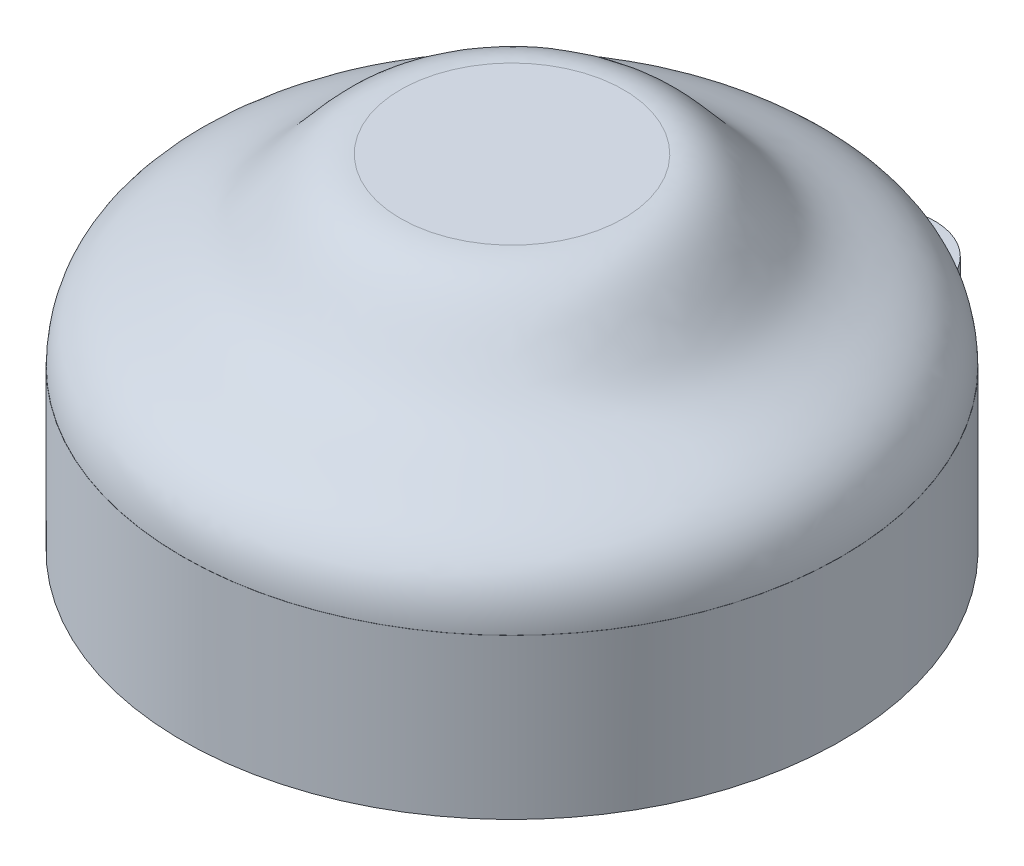
from build123d import *

# Parameters (mm, degrees)
SKETCH3_R           = 26.878
SKETCH3_R_2         = 26.128
BOSS_EXTRUDE1_DEPTH = 13
SKETCH5_R           = 1.65
BOSS_EXTRUDE4_DEPTH = 5.5
CUT_EXTRUDE1_DEPTH  = 3.5
BOSS_EXTRUDE5_START = -3.5
BOSS_EXTRUDE5_DEPTH = 1.5
FILLET1_DEPTH       = 3.5
FILLET1_2_DEPTH     = 5.5
FILLET1_START       = 3.5
FILLET1_3_DEPTH     = 2


with BuildPart() as part:
    # Sketch3 → Boss-Extrude1 (new body)
    with BuildSketch(Plane(origin=(0, 0, 0), x_dir=(1, 0, 0), z_dir=(0, 1, 0))):
        with Locations(Location((0, 0, 0), (0, 0, 90))):
            Circle(SKETCH3_R)
        with Locations(Location((0, 0, 0), (0, 0, 90))):
            Circle(SKETCH3_R_2, mode=Mode.SUBTRACT)
    extrude(amount=BOSS_EXTRUDE1_DEPTH)

    # Sketch5 → Boss-Extrude4 (add)
    with BuildSketch(Plane.XZ):
        with BuildLine():
            Line((-5.543162198, -29.995394675), (-5.543162198, -26.300194616))
            ThreePointArc((-5.543162198, -26.300194616), (-0.534858171, -26.863033142), (4.491880525, -26.499997988))
            Line((4.491880525, -26.499997988), (4.491880525, -29.995394675))
            ThreePointArc((4.491880525, -29.995394675), (-0.525640836, -35.012916036), (-5.543162198, -29.995394675))
        make_face()
        with Locations(Location((-0.525640836, -29.995394675, 0), (0, 0, 270))):
            Circle(SKETCH5_R, mode=Mode.SUBTRACT)
    extrude(amount=-BOSS_EXTRUDE4_DEPTH)

    # Sketch6 → Cut-Extrude1 (cut)
    with BuildSketch(Plane(origin=(0, 0, 0), x_dir=(-1, 0, 0), z_dir=(0, -1, 0))):
        with BuildLine():
            Line((4.710133197, 29.995394675), (4.710133197, 25.699942204))
            ThreePointArc((4.710133197, 25.699942204), (0.530383369, 26.096098926), (-3.658851524, 25.81760336))
            Line((-3.658851524, 25.81760336), (-3.658851524, 29.995394675))
            ThreePointArc((-3.658851524, 29.995394675), (0.525640836, 34.179887036), (4.710133197, 29.995394675))
        make_face()
    extrude(amount=-CUT_EXTRUDE1_DEPTH, mode=Mode.SUBTRACT)

    # Sketch8 → Boss-Extrude5 (add)
    with BuildSketch(Plane.XZ.offset(BOSS_EXTRUDE5_START)):
        with BuildLine():
            Line((-24.490295897, -5.022490106), (-25.599662863, -5.25))
            ThreePointArc((-25.599662863, -5.25), (0, -26.132455658), (25.599662863, -5.25))
            Line((25.599662863, -5.25), (24.490295897, -5.022490106))
            ThreePointArc((24.490295897, -5.022490106), (0, -25), (-24.490295897, -5.022490106))
        make_face()
    extrude(amount=-BOSS_EXTRUDE5_DEPTH)

    # Sketch9 → Revolve2 (revolve)
    with BuildSketch(Plane.XY, mode=Mode.PRIVATE) as revolve2_sk:
        with BuildLine():
            Line((0, 28), (-9.101139649, 28))
            add(Edge.make_bspline(
                [(-26.865197812, 13), (-26.780347086, 19.183911548), (-16.270727798, 18.725740026), (-13.002848085, 28.026430598), (-9.101139649, 28)],
                knots=[0, 0, 0, 0, 0.568593296, 1, 1, 1, 1], degree=3))
            Line((-26.865197812, 13), (-26.077563706, 13))
            add(Edge.make_bspline(
                [(-26.077563706, 13), (-26.008610768, 18.688342048), (-15.742101247, 18.498770299), (-12.722171974, 27.285632832), (-8.970863985, 27.25)],
                knots=[0, 0, 0, 0, 0.575100983, 1, 1, 1, 1], degree=3))
            Line((-8.970863985, 27.25), (0, 27.25))
            Line((0, 27.25), (0, 28))
        make_face()
    revolve(revolve2_sk.sketch.rotate(Axis((0, 30.1875, 0), (0, -1, 0)), 99.620474841), axis=Axis((0, 30.1875, 0), (0, -1, 0)))

    # Fillet1: read off the stored shape, not the designer's step
    # Fillet1 outline → Fillet1 (cut)
    with BuildSketch(Plane(origin=(0, 0, 0), x_dir=(1, 0, 0), z_dir=(0, 1, 0))):
        with BuildLine():
            ThreePointArc((3.658851524, 25.870546757), (5.477109504, 25.547478456), (7.268005417, 25.096782289))
            ThreePointArc((7.268005417, 25.096782289), (6.09952046, 25.604116819), (5.097161214, 26.390260165))
            ThreePointArc((5.097161214, 26.390260165), (4.794834821, 26.446860741), (4.491880525, 26.499997988))
            Line((4.491880525, 26.499997988), (4.491880525, 27.136047571))
            ThreePointArc((4.491880525, 27.136047571), (3.87163652, 28.45633062), (3.658851524, 29.899442708))
            Line((3.658851524, 29.899442708), (3.658851524, 25.870546757))
        make_face()
        with BuildLine():
            ThreePointArc((-6.026648148, 26.19363274), (-7.000597737, 25.37255563), (-8.150422776, 24.824242034))
            ThreePointArc((-8.150422776, 24.824242034), (-6.445167778, 25.320588388), (-4.710133197, 25.699942204))
            Line((-4.710133197, 25.699942204), (-4.710133197, 29.574747629))
            ThreePointArc((-4.710133197, 29.574747629), (-4.922918193, 28.131635539), (-5.543162198, 26.81135249))
            Line((-5.543162198, 26.81135249), (-5.543162198, 26.300194616))
            ThreePointArc((-5.543162198, 26.300194616), (-5.785150535, 26.248026922), (-6.026648148, 26.19363274))
        make_face()
    extrude(amount=FILLET1_DEPTH, mode=Mode.SUBTRACT)

    # Fillet1 2 outline → Fillet1 2 (add)
    with BuildSketch(Plane(origin=(0, 0, 0), x_dir=(1, 0, 0), z_dir=(0, 1, 0))):
        with BuildLine():
            ThreePointArc((4.491880525, 27.136047571), (4.776571122, 26.748585862), (5.097161214, 26.390260165))
            ThreePointArc((5.097161214, 26.390260165), (6.556196133, 26.066130826), (7.994958398, 25.661401447))
            ThreePointArc((7.994958398, 25.661401447), (5.52106858, 27.38398005), (4.487045069, 30.215623257))
            ThreePointArc((4.487045069, 30.215623257), (4.490671515, 30.105535505), (4.491880525, 29.995394675))
            Line((4.491880525, 29.995394675), (4.491880525, 27.136047571))
        make_face()
        with BuildLine():
            ThreePointArc((-8.889156848, 25.365523344), (-7.469387589, 25.819278321), (-6.026648148, 26.19363274))
            ThreePointArc((-6.026648148, 26.19363274), (-5.772772474, 26.492996416), (-5.543162198, 26.81135249))
            Line((-5.543162198, 26.81135249), (-5.543162198, 29.995394675))
            ThreePointArc((-5.543162198, 29.995394675), (-5.543112947, 30.017625977), (-5.542965196, 30.039856842))
            ThreePointArc((-5.542965196, 30.039856842), (-6.477140566, 27.173722816), (-8.889156848, 25.365523344))
        make_face()
    extrude(amount=FILLET1_2_DEPTH)

    # Fillet1 3 outline → Fillet1 3 (add)
    with BuildSketch(Plane(origin=(0, 0, 0), x_dir=(1, 0, 0), z_dir=(0, 1, 0)).offset(FILLET1_START)):
        with BuildLine():
            ThreePointArc((4.491880525, 26.499997988), (4.794834821, 26.446860741), (5.097161214, 26.390260165))
            ThreePointArc((5.097161214, 26.390260165), (4.776571122, 26.748585862), (4.491880525, 27.136047571))
            Line((4.491880525, 27.136047571), (4.491880525, 26.499997988))
        make_face()
        with BuildLine():
            ThreePointArc((-5.543162198, 26.81135249), (-5.772772474, 26.492996416), (-6.026648148, 26.19363274))
            ThreePointArc((-6.026648148, 26.19363274), (-5.785150535, 26.248026922), (-5.543162198, 26.300194616))
            Line((-5.543162198, 26.300194616), (-5.543162198, 26.81135249))
        make_face()
    extrude(amount=FILLET1_3_DEPTH)


solid = part.part
